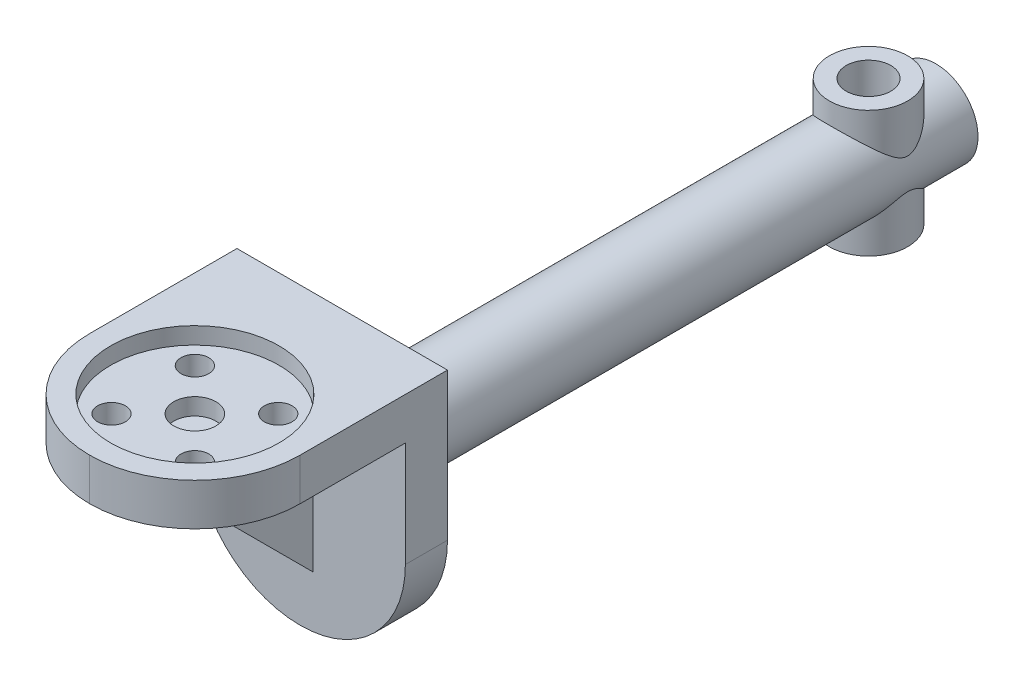
from build123d import *

# Parameters (mm, degrees)
SKETCH1_R                           = 5
BOSS_EXTRUDE1_DEPTH                 = 70.5
SKETCH3_W                           = 25
SKETCH3_H                           = 30
BOSS_EXTRUDE3_DEPTH                 = 5
SKETCH4_W                           = 25
SKETCH4_H                           = 5
BOSS_EXTRUDE4_DEPTH                 = 25
FILLET3_R                           = 12.5
CUT_EXTRUDE1_REACH                  = 107.624
SKETCH6_R                           = 1.65
SKETCH6_3_R                         = 10
SKETCH6_3_R_2                       = 1.65
SKETCH6_3_R_3                       = 2.5
CUT_EXTRUDE2_DEPTH                  = 2
SKETCH6_4_R                         = 2.5
CUT_EXTRUDE3_DEPTH                  = 4
FILLET4_R                           = 5
CUT_EXTRUDE4_REACH                  = 104.379
CUT_EXTRUDE4_END_RADIUS             = 5
SKETCH7_R                           = 2.65
CUT_EXTRUDE4_DIRECTION_2_REACH      = 104.379
CUT_EXTRUDE4_DIRECTION_2_END_RADIUS = 5
BOSS_EXTRUDE6_DEPTH                 = 7.5
BOSS_EXTRUDE6_DEPTH_BACK            = 7.5
SKETCH7_3_R                         = 4.65
SKETCH7_3_R_2                       = 2.65
BOSS_EXTRUDE7_DEPTH                 = 1.5
BOSS_EXTRUDE7_DEPTH_BACK            = 1.5


with BuildPart() as part:
    # Sketch1 → Boss-Extrude1 (new body)
    with BuildSketch(Plane(origin=(0, 0, 0), x_dir=(0, 1, 0), z_dir=(0, 0, 1))):
        with Locations(Location((0, 0, 0), (0, 0, 270))):
            Circle(SKETCH1_R)
    extrude(amount=BOSS_EXTRUDE1_DEPTH)

    # Sketch3 → Boss-Extrude3 (add)
    with BuildSketch(Plane.XY.offset(70.5)):
        Rectangle(SKETCH3_W, SKETCH3_H)
    extrude(amount=BOSS_EXTRUDE3_DEPTH)

    # Sketch4 → Boss-Extrude4 (add)
    with BuildSketch(Plane.XY.offset(75.5)):
        with Locations((0, 12.5)):
            Rectangle(SKETCH4_W, SKETCH4_H)
    extrude(amount=BOSS_EXTRUDE4_DEPTH)

    # Fillet3
    fillet3_edges = [part.edges().sort_by_distance(p)[0] for p in [
        (12.5, 12.5, 100.5),
        (-12.5, 12.5, 100.5),
        (-12.5, -15, 73),
        (12.5, -15, 73),
    ]]
    fillet(fillet3_edges, radius=FILLET3_R - 0.0001)  # a hair under: the kernel refuses the full size

    # Sketch6 → Cut-Extrude1 (cut, up to next)
    with BuildSketch(Plane(origin=(0, 15, 0), x_dir=(-1, 0, 0), z_dir=(0, 1, 0)), mode=Mode.PRIVATE) as cut_extrude1_sk1:
        with Locations(Location((-4.949747468, 92.949747468, 0), (0, 0, 90))):
            Circle(SKETCH6_R)
    cut_extrude1_tool1 = extrude(cut_extrude1_sk1.sketch, amount=-CUT_EXTRUDE1_REACH, mode=Mode.PRIVATE) & part.part
    # Sketch6 → Cut-Extrude1 (cut, up to next)
    with BuildSketch(Plane(origin=(0, 15, 0), x_dir=(-1, 0, 0), z_dir=(0, 1, 0)), mode=Mode.PRIVATE) as cut_extrude1_sk2:
        with Locations(Location((4.949747468, 92.949747468, 0), (0, 0, 90))):
            Circle(SKETCH6_R)
    cut_extrude1_tool2 = extrude(cut_extrude1_sk2.sketch, amount=-CUT_EXTRUDE1_REACH, mode=Mode.PRIVATE) & part.part
    # Sketch6 → Cut-Extrude1 (cut, up to next)
    with BuildSketch(Plane(origin=(0, 15, 0), x_dir=(-1, 0, 0), z_dir=(0, 1, 0)), mode=Mode.PRIVATE) as cut_extrude1_sk3:
        with Locations(Location((-4.949747468, 83.050252532, 0), (0, 0, 90))):
            Circle(SKETCH6_R)
    cut_extrude1_tool3 = extrude(cut_extrude1_sk3.sketch, amount=-CUT_EXTRUDE1_REACH, mode=Mode.PRIVATE) & part.part
    # Sketch6 → Cut-Extrude1 (cut, up to next)
    with BuildSketch(Plane(origin=(0, 15, 0), x_dir=(-1, 0, 0), z_dir=(0, 1, 0)), mode=Mode.PRIVATE) as cut_extrude1_sk4:
        with Locations(Location((4.949747468, 83.050252532, 0), (0, 0, 90))):
            Circle(SKETCH6_R)
    cut_extrude1_tool4 = extrude(cut_extrude1_sk4.sketch, amount=-CUT_EXTRUDE1_REACH, mode=Mode.PRIVATE) & part.part
    add(cut_extrude1_tool1.solids().sort_by_distance((4.949747, 15, 92.949747))[0], mode=Mode.SUBTRACT)
    add(cut_extrude1_tool2.solids().sort_by_distance((-4.949747, 15, 92.949747))[0], mode=Mode.SUBTRACT)
    add(cut_extrude1_tool3.solids().sort_by_distance((4.949747, 15, 83.050253))[0], mode=Mode.SUBTRACT)
    add(cut_extrude1_tool4.solids().sort_by_distance((-4.949747, 15, 83.050253))[0], mode=Mode.SUBTRACT)

    # Sketch6<3> → Cut-Extrude2 (cut)
    # profile 1 of 6: a face of its own
    with BuildSketch(Plane(origin=(0, 15, 0), x_dir=(-1, 0, 0), z_dir=(0, 1, 0))):
        with Locations(Location((0, 88, 0), (0, 0, 90))):
            Circle(SKETCH6_3_R)
        with Locations(Location((4.949747468, 83.050252532, 0), (0, 0, 90))):
            Circle(SKETCH6_3_R_2, mode=Mode.SUBTRACT)
        with Locations(Location((-4.949747468, 83.050252532, 0), (0, 0, 90))):
            Circle(SKETCH6_3_R_2, mode=Mode.SUBTRACT)
        with Locations(Location((4.949747468, 92.949747468, 0), (0, 0, 90))):
            Circle(SKETCH6_3_R_2, mode=Mode.SUBTRACT)
        with Locations(Location((-4.949747468, 92.949747468, 0), (0, 0, 90))):
            Circle(SKETCH6_3_R_2, mode=Mode.SUBTRACT)
        with Locations((0, 88)):
            Circle(SKETCH6_3_R_3, mode=Mode.SUBTRACT)
    # profile 2 of 6: a face of its own
    with BuildSketch(Plane(origin=(0, 15, 0), x_dir=(-1, 0, 0), z_dir=(0, 1, 0))):
        with Locations(Location((4.949747468, 92.949747468, 0), (0, 0, 90))):
            Circle(SKETCH6_3_R_2)
    # profile 3 of 6: a face of its own
    with BuildSketch(Plane(origin=(0, 15, 0), x_dir=(-1, 0, 0), z_dir=(0, 1, 0))):
        with Locations(Location((-4.949747468, 92.949747468, 0), (0, 0, 90))):
            Circle(SKETCH6_3_R_2)
    # profile 4 of 6: a face of its own
    with BuildSketch(Plane(origin=(0, 15, 0), x_dir=(-1, 0, 0), z_dir=(0, 1, 0))):
        with Locations(Location((-4.949747468, 83.050252532, 0), (0, 0, 90))):
            Circle(SKETCH6_3_R_2)
    # profile 5 of 6: a face of its own
    with BuildSketch(Plane(origin=(0, 15, 0), x_dir=(-1, 0, 0), z_dir=(0, 1, 0))):
        with Locations(Location((4.949747468, 83.050252532, 0), (0, 0, 90))):
            Circle(SKETCH6_3_R_2)
    # profile 6 of 6: a face of its own
    with BuildSketch(Plane(origin=(0, 15, 0), x_dir=(-1, 0, 0), z_dir=(0, 1, 0))):
        with Locations((0, 88)):
            Circle(SKETCH6_3_R_3)
    extrude(amount=-CUT_EXTRUDE2_DEPTH, mode=Mode.SUBTRACT)

    # Sketch6<4> → Cut-Extrude3 (cut)
    with BuildSketch(Plane(origin=(0, 15, 0), x_dir=(-1, 0, 0), z_dir=(0, 1, 0))):
        with Locations(Location((0, 88, 0), (0, 0, 90))):
            Circle(SKETCH6_4_R)
    extrude(amount=-CUT_EXTRUDE3_DEPTH, mode=Mode.SUBTRACT)

    # Fillet4
    fillet4_edges = [part.edges().sort_by_distance(p)[0] for p in [
        (-5, 0, 70.5),
    ]]
    fillet(fillet4_edges, radius=FILLET4_R)

    # Cut-Extrude4: up to this cylinder (the profile starts inside it)
    cut_extrude4_end = Plane(origin=(0, 0, 8), z_dir=(0, 0, -1)) * Cylinder(CUT_EXTRUDE4_END_RADIUS, 219.758, mode=Mode.PRIVATE)
    # Sketch7 → Cut-Extrude4 (cut, up to the surface)
    with BuildSketch(Plane(origin=(0, 0, 0), x_dir=(-1, 0, 0), z_dir=(0, 1, 0)), mode=Mode.PRIVATE) as cut_extrude4_sk1:
        with Locations(Location((0, 8, 0), (0, 0, 270))):
            Circle(SKETCH7_R)
    cut_extrude4_tool1 = extrude(cut_extrude4_sk1.sketch, amount=-CUT_EXTRUDE4_REACH, mode=Mode.PRIVATE) & cut_extrude4_end
    add(cut_extrude4_tool1.solids().sort_by_distance((0, 0, 8))[0], mode=Mode.SUBTRACT)

    # Cut-Extrude4 direction 2: up to this cylinder (the profile starts inside it)
    cut_extrude4_direction_2_end = Plane(origin=(0, 0, 8), z_dir=(0, 0, -1)) * Cylinder(CUT_EXTRUDE4_DIRECTION_2_END_RADIUS, 219.758, mode=Mode.PRIVATE)
    # Sketch7 → Cut-Extrude4 direction 2 (cut, up to the surface)
    with BuildSketch(Plane(origin=(0, 0, 0), x_dir=(-1, 0, 0), z_dir=(0, 1, 0)), mode=Mode.PRIVATE) as cut_extrude4_direction_2_sk1:
        with Locations(Location((0, 8, 0), (0, 0, 270))):
            Circle(SKETCH7_R)
    cut_extrude4_direction_2_tool1 = extrude(cut_extrude4_direction_2_sk1.sketch, amount=CUT_EXTRUDE4_DIRECTION_2_REACH, mode=Mode.PRIVATE) & cut_extrude4_direction_2_end
    add(cut_extrude4_direction_2_tool1.solids().sort_by_distance((0, 0, 8))[0], mode=Mode.SUBTRACT)

    # Sketch7<3> → Boss-Extrude6 (add, two sides: drawn at the far end of the back side and taken through both)
    with BuildSketch(Plane(origin=(0, 0, 0), x_dir=(-1, 0, 0), z_dir=(0, 1, 0)).offset(-BOSS_EXTRUDE6_DEPTH_BACK)):
        with Locations(Location((0, 8, 0), (0, 0, 90))):
            Circle(SKETCH7_3_R)
        with Locations(Location((0, 8, 0), (0, 0, 270))):
            Circle(SKETCH7_3_R_2, mode=Mode.SUBTRACT)
    extrude(amount=BOSS_EXTRUDE6_DEPTH + BOSS_EXTRUDE6_DEPTH_BACK)

    # Sketch9 → Boss-Extrude7 (add, two sides: drawn at the far end of the back side and taken through both)
    with BuildSketch(Plane(origin=(0, 0, 0), x_dir=(0, -1, 0), z_dir=(-1, 0, 0)).offset(-BOSS_EXTRUDE7_DEPTH_BACK)):
        Polygon((-10, 94.25), (8.75, 75.5), (-10, 75.5), align=None)
    extrude(amount=BOSS_EXTRUDE7_DEPTH + BOSS_EXTRUDE7_DEPTH_BACK)


solid = part.part
